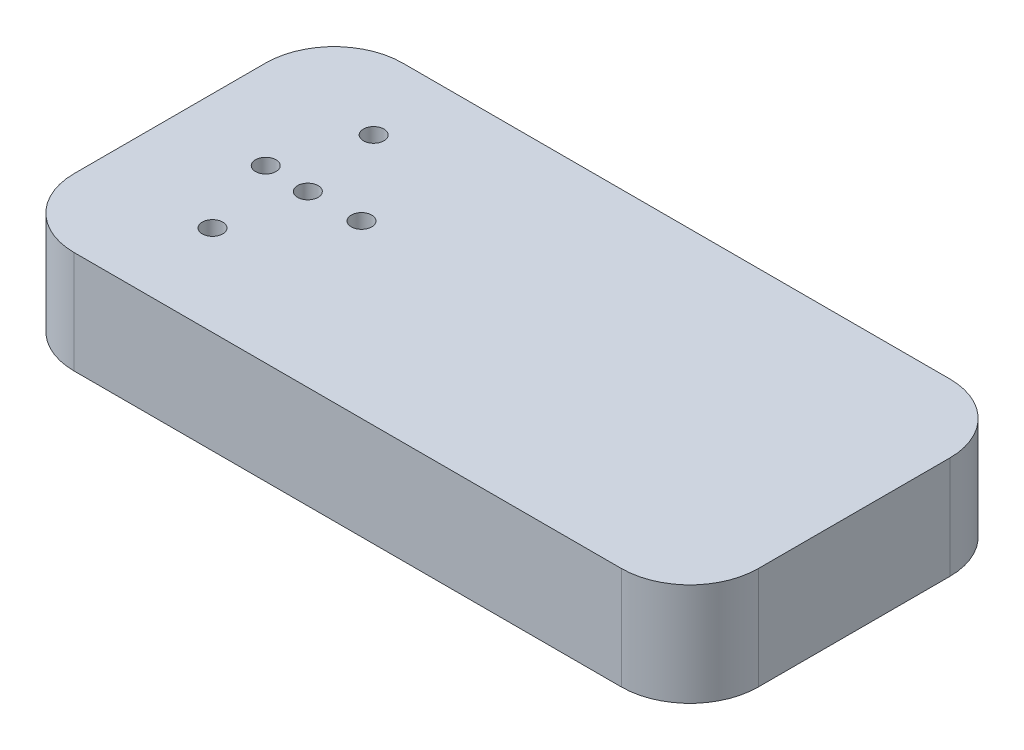
from build123d import *

# Parameters (mm, degrees)
BODY_GLIDER_RIGHT_DEPTH      = 25
BODY_GLIDER_RIGHT_DEPTH_BACK = 23
SKETCH6_W                    = 1.5
SKETCH6_H                    = 10
SKETCH8_W                    = 1.5
SKETCH8_H                    = 10
NUTRIGHTWING_DEPTH           = 34
NUTLEFTWING_DEPTH            = 24
SKETCH19_R                   = 1.5
CUT_EXTRUDE8_DEPTH           = 35
SKETCH20_R                   = 3
CUT_EXTRUDE9_DEPTH           = 5
FILLET4_R                    = 10
SKETCH21_R                   = 1.5
CUT_EXTRUDE10_DEPTH          = 10


with BuildPart() as part:
    # Sketch9 → Body_Glider_Right (new, two sides: drawn at the far end of the back side and taken through both)
    with BuildSketch(Plane.XY.offset(-BODY_GLIDER_RIGHT_DEPTH_BACK)):
        Polygon((100, 0), (0, 0), (0, 15), (9.991154054, 15), (100, 15), align=None)
    extrude(amount=BODY_GLIDER_RIGHT_DEPTH + BODY_GLIDER_RIGHT_DEPTH_BACK)

    # Sketch6 → BallBearingHoleRW (revolve, cut)
    with BuildSketch(Plane(origin=(0, 0, 0), x_dir=(0.8219256175556252, 0, -0.5695948377626013), z_dir=(0.5695948377626013, 0, 0.8219256175556252))):
        with Locations((21.433136815, 17)):
            Rectangle(SKETCH6_W, SKETCH6_H)
    revolve(axis=Axis((17, 15, -11.781007959), (0, 1, 0)), mode=Mode.SUBTRACT)

    # Sketch8 → BallBearingHoleLW (revolve, cut)
    with BuildSketch(Plane(origin=(0, 0, 0), x_dir=(0.8219256175556252, 0, 0.5695948377626013), z_dir=(-0.5695948377626013, 0, 0.8219256175556252))):
        with Locations((19.933136815, 17)):
            Rectangle(SKETCH8_W, SKETCH8_H)
    revolve(axis=Axis((17, 15, 11.781007959), (0, 1, 0)), mode=Mode.SUBTRACT)

    # Sketch14 → NutRightWing (cut)
    with BuildSketch(Plane(origin=(0, 12, 0), x_dir=(0.9996495647624771, -5.672545766444159e-15, -0.026471638978162328), z_dir=(0, 1, 0))):
        Polygon((19.738302287, -13.595637628), (19.395605009, -10.264587957), (16.339482734, -8.89584767), (13.626057736, -10.858157054), (13.968755014, -14.189206725), (17.024877289, -15.557947012), align=None)
    extrude(amount=-NUTRIGHTWING_DEPTH, mode=Mode.SUBTRACT)

    # Sketch15 → NutLeftWing (cut)
    with BuildSketch(Plane(origin=(0, 12, 0), x_dir=(0.999649564762477, 0, 0.026471638978163528), z_dir=(0, 1, 0))):
        Polygon((13.729994888, 10.646411235), (16.574828568, 8.879986975), (19.527013691, 10.460473081), (19.634365135, 13.807383447), (16.789531455, 15.573807708), (13.837346332, 13.993321601), align=None)
    extrude(amount=-NUTLEFTWING_DEPTH, mode=Mode.SUBTRACT)

    # Sketch19 → Cut-Extrude8 (cut)
    with BuildSketch(Plane(origin=(0, 0, 0), x_dir=(1, 0, 0), z_dir=(0, 1, 0))):
        with Locations((13.001901128, 0)):
            Circle(SKETCH19_R)
        with Locations((27.001901128, 0)):
            Circle(SKETCH19_R)
    extrude(amount=CUT_EXTRUDE8_DEPTH, mode=Mode.SUBTRACT)

    # Sketch20 → Cut-Extrude9 (cut)
    with BuildSketch(Plane.XZ):
        with Locations((13.001901128, 0)):
            Circle(SKETCH20_R)
        with Locations((27.001901128, 0)):
            Circle(SKETCH20_R)
    extrude(amount=-CUT_EXTRUDE9_DEPTH, mode=Mode.SUBTRACT)

    # Fillet4
    fillet4_edges = [part.edges().sort_by_distance(p)[0] for p in [
        (100, 7.5, -23),
        (100, 7.5, 25),
        (0, 7.5, -23),
        (0, 7.5, 25),
    ]]
    fillet(fillet4_edges, radius=FILLET4_R)

    # Sketch21 → Cut-Extrude10 (cut)
    with BuildSketch(Plane(origin=(0, 15, 0), x_dir=(1, 0, 0), z_dir=(0, 1, 0))):
        with Locations((19.34746369, -0.193474637)):
            Circle(SKETCH21_R)
    extrude(amount=-CUT_EXTRUDE10_DEPTH, mode=Mode.SUBTRACT)


solid = part.part
